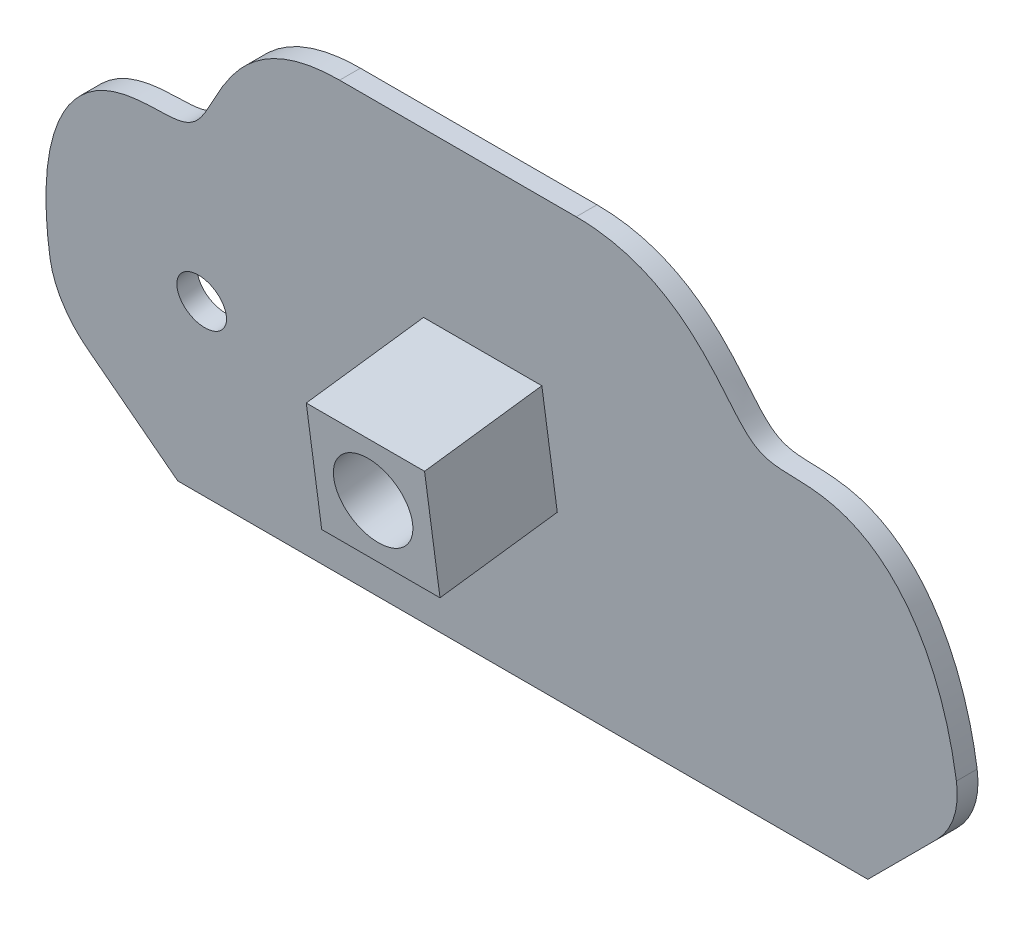
from build123d import *

# Parameters (mm, degrees)
BOSS_EXTRUDE1_START     = -25
BOSS_EXTRUDE1_DEPTH     = 50
CUT_EXTRUDE1_DEPTH      = 341.53226913
CUT_EXTRUDE1_DEPTH_BACK = 341.53226913
BOSS_EXTRUDE3_DEPTH     = 30
CUT_EXTRUDE2_DEPTH      = 350.338594582
CUT_EXTRUDE2_DEPTH_BACK = 350.338594582
SKETCH4_R               = 20
CUT_EXTRUDE3_DEPTH      = 350.338594582
CUT_EXTRUDE3_DEPTH_BACK = 350.338594582
SKETCH6_R               = 12.5


# Read off the part's stored shape, not the designer's step: Boss-Extrude1
with BuildPart() as part:
    # Boss-Extrude1 outline → Boss-Extrude1 (new body)
    with BuildSketch(Plane.XY.offset(BOSS_EXTRUDE1_START)):
        with BuildLine():
            Line((175, 0), (215.218833807, 40.218833807))
            ThreePointArc((215.218833807, 40.218833807), (226.057471223, 56.440000887), (229.863494748, 75.574172084))
            add(Edge.make_bspline(
                [(229.863494748, 75.574172084), (229.863497015, 220.574172084), (130.657195822, 208), (130.657198498, 108), (160, 250), (60, 250)],
                knots=[0, 0, 0, 0, 0, 0, 1, 1, 1, 1, 1, 1], degree=5))
            Line((60, 250), (-60, 250))
            add(Edge.make_bspline(
                [(-60, 250), (-160, 250), (-130.657198498, 108), (-130.657195822, 208), (-229.863497015, 220.574172084), (-229.863494748, 75.574172084)],
                knots=[0, 0, 0, 0, 0, 0, 1, 1, 1, 1, 1, 1], degree=5))
            ThreePointArc((-229.863494748, 75.574172084), (-226.057471223, 56.440000887), (-215.218833807, 40.218833807))
            Line((-215.218833807, 40.218833807), (-175, 0))
            Line((-175, 0), (175, 0))
        make_face()
    extrude(amount=BOSS_EXTRUDE1_DEPTH)

    # Sketch2 → Cut-Extrude1 (cut, two sides: drawn at the far end of the back side and taken through both)
    with BuildSketch(Plane(origin=(0, 0, 0), x_dir=(0, 0, -1), z_dir=(1, 0, 0)).offset(-CUT_EXTRUDE1_DEPTH_BACK)):
        Polygon((23.039732542, -10), (-12.506441807, 260), (35, 260), (35, -10), align=None)
        Polygon((-23.039732542, 260), (12.506441807, -10), (-35, -10), (-35, 260), align=None)
    extrude(amount=CUT_EXTRUDE1_DEPTH + CUT_EXTRUDE1_DEPTH_BACK, mode=Mode.SUBTRACT)

    # Sketch11 → Boss-Extrude3 (add, symmetric)
    with BuildSketch(Plane(origin=(0, 0, 0), x_dir=(0, 0, -1), z_dir=(1, 0, 0))):
        Polygon((-9.148641973, 154.486691682), (-1.31707044, 95), (-60.803762122, 87.168428467), (-68.635333655, 146.655120149), align=None)
    extrude(amount=BOSS_EXTRUDE3_DEPTH, both=True)

    # Sketch4 → Cut-Extrude2 (cut, two sides: drawn at the far end of the back side and taken through both)
    with BuildSketch(Plane(origin=(0, 2.811189919, -21.353107392), x_dir=(-1, 0, 0), z_dir=(0, 0.13052619222005532, -0.99144486137381)).offset(-CUT_EXTRUDE2_DEPTH_BACK)):
        with Locations(Location((0, 124.321792579, 0), (0, 0, 90))):
            Circle(SKETCH4_R)
    extrude(amount=CUT_EXTRUDE2_DEPTH + CUT_EXTRUDE2_DEPTH_BACK, mode=Mode.SUBTRACT)

    # Sketch6 → Cut-Extrude3 (cut, two sides: drawn at the far end of the back side and taken through both)
    with BuildSketch(Plane(origin=(0, 2.811189919, -21.353107392), x_dir=(-1, 0, 0), z_dir=(0, 0.13052619222005532, -0.99144486137381)).offset(-CUT_EXTRUDE3_DEPTH_BACK)):
        with Locations(Location((150, 97.164552434, 0), (0, 0, 90))):
            Circle(SKETCH6_R)
    extrude(amount=CUT_EXTRUDE3_DEPTH + CUT_EXTRUDE3_DEPTH_BACK, mode=Mode.SUBTRACT)


solid = part.part
